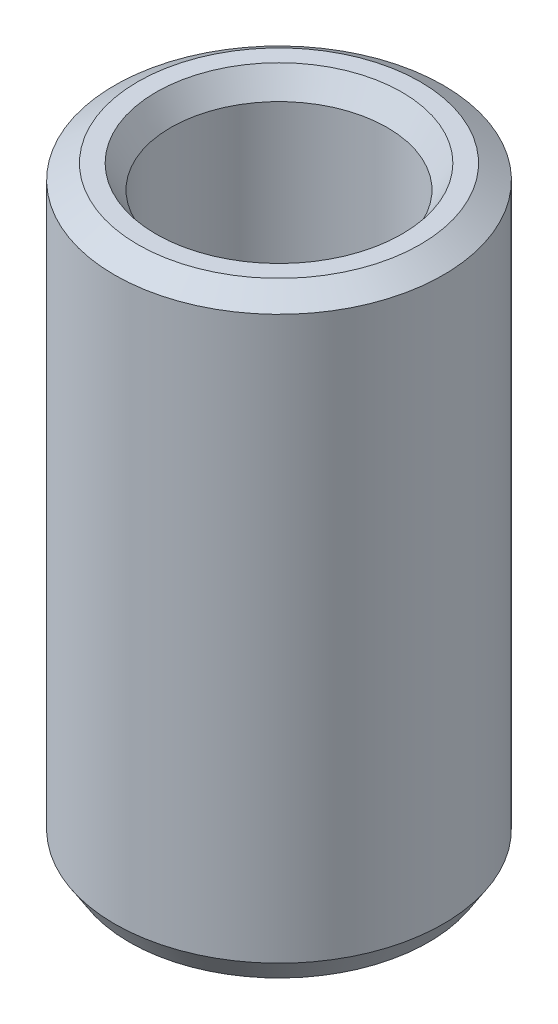
from build123d import *
from OCP.BRepFilletAPI import BRepFilletAPI_MakeChamfer

# Parameters (mm, degrees)
SKETCH1_R           = 17.5
BOSS_EXTRUDE1_DEPTH = 63.882335277
SKETCH2_R           = 11.521860293
CUT_EXTRUDE1_DEPTH  = 69.508778711
CHAMFER1_SIZE       = 1.570796883
CHAMFER1_SIZE2      = 2.472262297


with BuildPart() as part:
    # Sketch1 → Boss-Extrude1 (new body)
    with BuildSketch(Plane(origin=(0, 0, 0), x_dir=(1, 0, 0), z_dir=(0, 1, 0))):
        Circle(SKETCH1_R)
    extrude(amount=BOSS_EXTRUDE1_DEPTH)

    # Sketch2 → Cut-Extrude1 (cut, through all)
    with BuildSketch(Plane(origin=(0, 0, 0), x_dir=(1, 0, 0), z_dir=(0, 1, 0))):
        Circle(SKETCH2_R)
    extrude(amount=CUT_EXTRUDE1_DEPTH, mode=Mode.SUBTRACT)

    # Chamfer1: one chamfer whose edges measure the first distance from different faces: ONE call of the kernel's chamfer builder (chamfer() names one face for all edges)
    chamfer1_edges_1 = [part.edges().sort_by_distance(p)[0] for p in [
        (-11.521860293, 63.882335277, 0),
    ]]
    chamfer1_side_1 = [part.faces().sort_by_distance(p)[0] for p in [
        (-17.005025253, 63.882335277, 0),
    ]]
    chamfer1_edges_2 = [part.edges().sort_by_distance(p)[0] for p in [
        (-11.521860293, 0, 0),
    ]]
    chamfer1_side_2 = [part.faces().sort_by_distance(p)[0] for p in [
        (-11.521860293, 31.941167639, 0),
    ]]
    chamfer1_edges_3 = [part.edges().sort_by_distance(p)[0] for p in [
        (-17.5, 0, 0),
    ]]
    chamfer1_side_3 = [part.faces().sort_by_distance(p)[0] for p in [
        (-17.005025253, 0, 0),
    ]]
    chamfer1_edges_4 = [part.edges().sort_by_distance(p)[0] for p in [
        (-17.5, 63.882335277, 0),
    ]]
    chamfer1_side_4 = [part.faces().sort_by_distance(p)[0] for p in [
        (-17.5, 31.941167639, 0),
    ]]
    chamfer1 = BRepFilletAPI_MakeChamfer(part.part.solid().wrapped)
    for e in chamfer1_edges_1:
        chamfer1.Add(CHAMFER1_SIZE, CHAMFER1_SIZE2, e.wrapped, chamfer1_side_1[0].wrapped)  # the first distance lies on this face
    for e in chamfer1_edges_2:
        chamfer1.Add(CHAMFER1_SIZE, CHAMFER1_SIZE2, e.wrapped, chamfer1_side_2[0].wrapped)  # the first distance lies on this face
    for e in chamfer1_edges_3:
        chamfer1.Add(CHAMFER1_SIZE, CHAMFER1_SIZE2, e.wrapped, chamfer1_side_3[0].wrapped)  # the first distance lies on this face
    for e in chamfer1_edges_4:
        chamfer1.Add(CHAMFER1_SIZE, CHAMFER1_SIZE2, e.wrapped, chamfer1_side_4[0].wrapped)  # the first distance lies on this face
    add(Compound.cast(chamfer1.Shape()), mode=Mode.REPLACE)


solid = part.part
